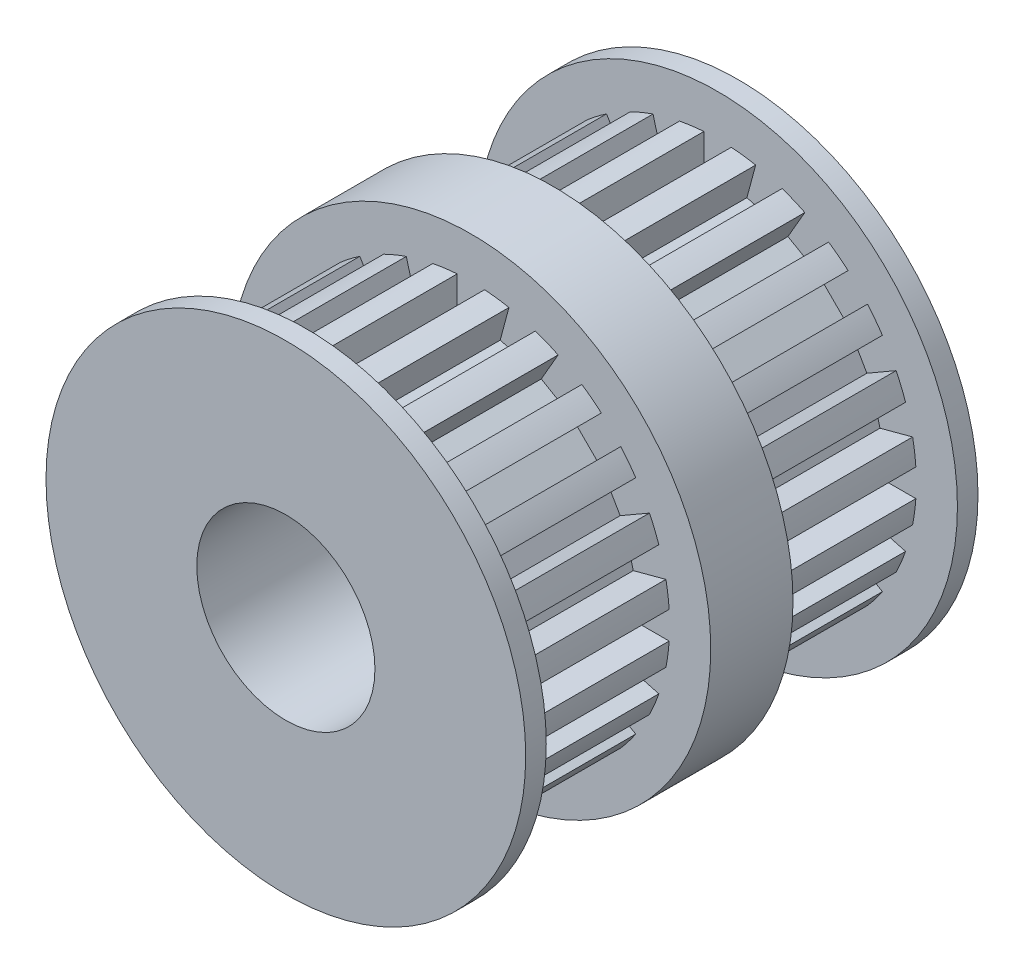
from build123d import *
from build123d.topology import SkipClean

# Parameters (mm, degrees)
SKETCH1_R                = 8.89
BOSS_EXTRUDE1_DEPTH      = 0.762
SKETCH2_R                = 7.366
BOSS_EXTRUDE2_DEPTH      = 6.096
SKETCH3_R                = 8.89
BOSS_EXTRUDE3_DEPTH      = 5.334
SKETCH4_R                = 3.302
CUT_EXTRUDE1_DEPTH       = 57.912
SKETCH5_W                = 6.096
SKETCH5_H                = 1.016
CUT_EXTRUDE2_DEPTH       = 1.27
CIRPATTERN1_COUNT        = 24
CUT_EXTRUDE3_DEPTH       = 152.4
CUT_EXTRUDE3_DEPTH_BACK  = 152.4
SKETCH6_W                = 17.78
SKETCH6_H                = 3.81
SKETCH7_R                = 8.89
BOSS_EXTRUDE4_DEPTH      = 1.524
MIRROR8_COPY_1_SKETCH_W  = 6.096
MIRROR8_COPY_1_SKETCH_H  = 1.016
MIRROR8_COPY_1_DEPTH     = 1.27
MIRROR8_COPY_2_SKETCH_W  = 6.096
MIRROR8_COPY_2_SKETCH_H  = 1.016
MIRROR8_COPY_2_DEPTH     = 1.27
MIRROR8_COPY_3_SKETCH_W  = 6.096
MIRROR8_COPY_3_SKETCH_H  = 1.016
MIRROR8_COPY_3_DEPTH     = 1.27
MIRROR8_COPY_4_SKETCH_W  = 6.096
MIRROR8_COPY_4_SKETCH_H  = 1.016
MIRROR8_COPY_4_DEPTH     = 1.27
MIRROR8_COPY_5_SKETCH_W  = 6.096
MIRROR8_COPY_5_SKETCH_H  = 1.016
MIRROR8_COPY_5_DEPTH     = 1.27
MIRROR8_COPY_6_SKETCH_W  = 6.096
MIRROR8_COPY_6_SKETCH_H  = 1.016
MIRROR8_COPY_6_DEPTH     = 1.27
MIRROR8_COPY_7_SKETCH_W  = 6.096
MIRROR8_COPY_7_SKETCH_H  = 1.016
MIRROR8_COPY_7_DEPTH     = 1.27
MIRROR8_COPY_8_SKETCH_W  = 6.096
MIRROR8_COPY_8_SKETCH_H  = 1.016
MIRROR8_COPY_8_DEPTH     = 1.27
MIRROR8_COPY_9_SKETCH_W  = 6.096
MIRROR8_COPY_9_SKETCH_H  = 1.016
MIRROR8_COPY_9_DEPTH     = 1.27
MIRROR8_COPY_10_SKETCH_W = 6.096
MIRROR8_COPY_10_SKETCH_H = 1.016
MIRROR8_COPY_10_DEPTH    = 1.27
MIRROR8_COPY_11_SKETCH_W = 6.096
MIRROR8_COPY_11_SKETCH_H = 1.016
MIRROR8_COPY_11_DEPTH    = 1.27
MIRROR8_COPY_12_SKETCH_W = 6.096
MIRROR8_COPY_12_SKETCH_H = 1.016
MIRROR8_COPY_12_DEPTH    = 1.27
MIRROR8_COPY_13_SKETCH_W = 6.096
MIRROR8_COPY_13_SKETCH_H = 1.016
MIRROR8_COPY_13_DEPTH    = 1.27
MIRROR8_COPY_14_SKETCH_W = 6.096
MIRROR8_COPY_14_SKETCH_H = 1.016
MIRROR8_COPY_14_DEPTH    = 1.27
MIRROR8_COPY_15_SKETCH_W = 6.096
MIRROR8_COPY_15_SKETCH_H = 1.016
MIRROR8_COPY_15_DEPTH    = 1.27
MIRROR8_COPY_16_SKETCH_W = 6.096
MIRROR8_COPY_16_SKETCH_H = 1.016
MIRROR8_COPY_16_DEPTH    = 1.27
MIRROR8_COPY_17_SKETCH_W = 6.096
MIRROR8_COPY_17_SKETCH_H = 1.016
MIRROR8_COPY_17_DEPTH    = 1.27
MIRROR8_COPY_18_SKETCH_W = 6.096
MIRROR8_COPY_18_SKETCH_H = 1.016
MIRROR8_COPY_18_DEPTH    = 1.27
MIRROR8_COPY_19_SKETCH_W = 6.096
MIRROR8_COPY_19_SKETCH_H = 1.016
MIRROR8_COPY_19_DEPTH    = 1.27
MIRROR8_COPY_20_SKETCH_W = 6.096
MIRROR8_COPY_20_SKETCH_H = 1.016
MIRROR8_COPY_20_DEPTH    = 1.27
MIRROR8_COPY_21_SKETCH_W = 6.096
MIRROR8_COPY_21_SKETCH_H = 1.016
MIRROR8_COPY_21_DEPTH    = 1.27
MIRROR8_COPY_22_SKETCH_W = 6.096
MIRROR8_COPY_22_SKETCH_H = 1.016
MIRROR8_COPY_22_DEPTH    = 1.27
MIRROR8_COPY_23_SKETCH_W = 6.096
MIRROR8_COPY_23_SKETCH_H = 1.016
MIRROR8_COPY_23_DEPTH    = 1.27
MIRROR8_COPY_24_SKETCH_W = 6.096
MIRROR8_COPY_24_SKETCH_H = 1.016
MIRROR8_COPY_24_DEPTH    = 1.27
CUT_EXTRUDE4_START       = -22.098
SKETCH8_R                = 3.302
CUT_EXTRUDE4_DEPTH       = 22.098


with BuildPart() as part:
    # Sketch1 → Boss-Extrude1 (new body)
    with BuildSketch(Plane.XY):
        Circle(SKETCH1_R)
    boss_extrude1 = extrude(amount=-BOSS_EXTRUDE1_DEPTH)

    # Sketch2 → Boss-Extrude2 (add)
    with BuildSketch(Plane(origin=(0, 0, -0.762), x_dir=(-1, 0, 0), z_dir=(0, 0, -1))):
        Circle(SKETCH2_R)
    boss_extrude2 = extrude(amount=BOSS_EXTRUDE2_DEPTH)

    # Sketch3 → Boss-Extrude3 (add)
    with BuildSketch(Plane(origin=(0, 0, -6.858), x_dir=(-1, 0, 0), z_dir=(0, 0, -1))):
        Circle(SKETCH3_R)
    extrude(amount=BOSS_EXTRUDE3_DEPTH)

    # Sketch4 → Cut-Extrude1 (cut)
    with BuildSketch(Plane.XY):
        Circle(SKETCH4_R)
    extrude(amount=-CUT_EXTRUDE1_DEPTH, mode=Mode.SUBTRACT)

    # Sketch5 → Cut-Extrude2 (cut)
    with BuildSketch(Plane.ZY.offset(7.366)):
        with Locations((-3.81, 0)):
            Rectangle(SKETCH5_W, SKETCH5_H)
    cut_extrude2 = extrude(amount=-CUT_EXTRUDE2_DEPTH, mode=Mode.SUBTRACT)

    # CirPattern1: Cut-Extrude2 ×24 about axis
    cirpattern1_axis = Axis((0, 0, -12.192), (0, 0, 1))
    for i in range(1, CIRPATTERN1_COUNT):
        add(cut_extrude2.rotate(cirpattern1_axis, i * 360 / CIRPATTERN1_COUNT), mode=Mode.SUBTRACT)

    # Sketch6 → Cut-Extrude3 (cut, two sides: drawn at the far end of the back side and taken through both)
    with BuildSketch(Plane(origin=(0, 0, 0), x_dir=(1, 0, 0), z_dir=(0, 1, 0)).offset(-CUT_EXTRUDE3_DEPTH_BACK)):
        with Locations((0, 10.287)):
            Rectangle(SKETCH6_W, SKETCH6_H)
    extrude(amount=CUT_EXTRUDE3_DEPTH + CUT_EXTRUDE3_DEPTH_BACK, mode=Mode.SUBTRACT)

    # Sketch7 → Boss-Extrude4 (add)
    with BuildSketch(Plane(origin=(0, 0, -8.382), x_dir=(-1, 0, 0), z_dir=(0, 0, -1))):
        Circle(SKETCH7_R)
    extrude(amount=BOSS_EXTRUDE4_DEPTH)

    # Mirror7: Boss-Extrude2 across plane
    add(boss_extrude2.mirror(Plane(origin=(0, 0, -8.382), x_dir=(1, 0, 0), z_dir=(0, 0, -1))))

    # Mirror8 copy 1 sketch → Mirror8 copy 1 (cut)
    with BuildSketch(Plane(origin=(-7.115009636, -1.906461086, -16.764), x_dir=(0, 0, -1), z_dir=(-0.9659258262890683, -0.25881904510252074, 0))):
        with Locations((-3.81, 0)):
            Rectangle(MIRROR8_COPY_1_SKETCH_W, MIRROR8_COPY_1_SKETCH_H)
    extrude(amount=-MIRROR8_COPY_1_DEPTH, mode=Mode.SUBTRACT)

    # Mirror8 copy 2 sketch → Mirror8 copy 2 (cut)
    with BuildSketch(Plane(origin=(-6.379143124, -3.683, -16.764), x_dir=(0, 0, -1), z_dir=(-0.8660254037844387, -0.49999999999999994, 0))):
        with Locations((-3.81, 0)):
            Rectangle(MIRROR8_COPY_2_SKETCH_W, MIRROR8_COPY_2_SKETCH_H)
    extrude(amount=-MIRROR8_COPY_2_DEPTH, mode=Mode.SUBTRACT)

    # Mirror8 copy 3 sketch → Mirror8 copy 3 (cut)
    with BuildSketch(Plane(origin=(-5.20854855, -5.20854855, -16.764), x_dir=(0, 0, -1), z_dir=(-0.7071067811865476, -0.7071067811865475, 0))):
        with Locations((-3.81, 0)):
            Rectangle(MIRROR8_COPY_3_SKETCH_W, MIRROR8_COPY_3_SKETCH_H)
    extrude(amount=-MIRROR8_COPY_3_DEPTH, mode=Mode.SUBTRACT)

    # Mirror8 copy 4 sketch → Mirror8 copy 4 (cut)
    with BuildSketch(Plane(origin=(-3.683, -6.379143124, -16.764), x_dir=(0, 0, -1), z_dir=(-0.5000000000000001, -0.8660254037844386, 0))):
        with Locations((-3.81, 0)):
            Rectangle(MIRROR8_COPY_4_SKETCH_W, MIRROR8_COPY_4_SKETCH_H)
    extrude(amount=-MIRROR8_COPY_4_DEPTH, mode=Mode.SUBTRACT)

    # Mirror8 copy 5 sketch → Mirror8 copy 5 (cut)
    with BuildSketch(Plane(origin=(-1.906461086, -7.115009636, -16.764), x_dir=(0, 0, -1), z_dir=(-0.25881904510252074, -0.9659258262890683, 0))):
        with Locations((-3.81, 0)):
            Rectangle(MIRROR8_COPY_5_SKETCH_W, MIRROR8_COPY_5_SKETCH_H)
    extrude(amount=-MIRROR8_COPY_5_DEPTH, mode=Mode.SUBTRACT)

    # Mirror8 copy 6 sketch → Mirror8 copy 6 (cut)
    with BuildSketch(Plane(origin=(0, -7.366, -16.764), x_dir=(0, 0, -1), z_dir=(0, -1, 0))):
        with Locations((-3.81, 0)):
            Rectangle(MIRROR8_COPY_6_SKETCH_W, MIRROR8_COPY_6_SKETCH_H)
    extrude(amount=-MIRROR8_COPY_6_DEPTH, mode=Mode.SUBTRACT)

    # Mirror8 copy 7 sketch → Mirror8 copy 7 (cut)
    with BuildSketch(Plane(origin=(1.906461086, -7.115009636, -16.764), x_dir=(0, 0, -1), z_dir=(0.25881904510252085, -0.9659258262890683, 0))):
        with Locations((-3.81, 0)):
            Rectangle(MIRROR8_COPY_7_SKETCH_W, MIRROR8_COPY_7_SKETCH_H)
    extrude(amount=-MIRROR8_COPY_7_DEPTH, mode=Mode.SUBTRACT)

    # Mirror8 copy 8 sketch → Mirror8 copy 8 (cut)
    with BuildSketch(Plane(origin=(3.683, -6.379143124, -16.764), x_dir=(0, 0, -1), z_dir=(0.4999999999999998, -0.8660254037844387, 0))):
        with Locations((-3.81, 0)):
            Rectangle(MIRROR8_COPY_8_SKETCH_W, MIRROR8_COPY_8_SKETCH_H)
    extrude(amount=-MIRROR8_COPY_8_DEPTH, mode=Mode.SUBTRACT)

    # Mirror8 copy 9 sketch → Mirror8 copy 9 (cut)
    with BuildSketch(Plane(origin=(5.20854855, -5.20854855, -16.764), x_dir=(0, 0, -1), z_dir=(0.7071067811865475, -0.7071067811865476, 0))):
        with Locations((-3.81, 0)):
            Rectangle(MIRROR8_COPY_9_SKETCH_W, MIRROR8_COPY_9_SKETCH_H)
    extrude(amount=-MIRROR8_COPY_9_DEPTH, mode=Mode.SUBTRACT)

    # Mirror8 copy 10 sketch → Mirror8 copy 10 (cut)
    with BuildSketch(Plane(origin=(6.379143124, -3.683, -16.764), x_dir=(0, 0, -1), z_dir=(0.8660254037844387, -0.49999999999999994, 0))):
        with Locations((-3.81, 0)):
            Rectangle(MIRROR8_COPY_10_SKETCH_W, MIRROR8_COPY_10_SKETCH_H)
    extrude(amount=-MIRROR8_COPY_10_DEPTH, mode=Mode.SUBTRACT)

    # Mirror8 copy 11 sketch → Mirror8 copy 11 (cut)
    with BuildSketch(Plane(origin=(7.115009636, -1.906461086, -16.764), x_dir=(0, 0, -1), z_dir=(0.9659258262890682, -0.258819045102521, 0))):
        with Locations((-3.81, 0)):
            Rectangle(MIRROR8_COPY_11_SKETCH_W, MIRROR8_COPY_11_SKETCH_H)
    extrude(amount=-MIRROR8_COPY_11_DEPTH, mode=Mode.SUBTRACT)

    # Mirror8 copy 12 sketch → Mirror8 copy 12 (cut)
    with BuildSketch(Plane(origin=(7.366, 0, -16.764), x_dir=(0, 0, -1), z_dir=(1, 0, 0))):
        with Locations((-3.81, 0)):
            Rectangle(MIRROR8_COPY_12_SKETCH_W, MIRROR8_COPY_12_SKETCH_H)
    extrude(amount=-MIRROR8_COPY_12_DEPTH, mode=Mode.SUBTRACT)

    # Mirror8 copy 13 sketch → Mirror8 copy 13 (cut)
    with BuildSketch(Plane(origin=(7.115009636, 1.906461086, -16.764), x_dir=(0, 0, -1), z_dir=(0.9659258262890683, 0.2588190451025208, 0))):
        with Locations((-3.81, 0)):
            Rectangle(MIRROR8_COPY_13_SKETCH_W, MIRROR8_COPY_13_SKETCH_H)
    extrude(amount=-MIRROR8_COPY_13_DEPTH, mode=Mode.SUBTRACT)

    # Mirror8 copy 14 sketch → Mirror8 copy 14 (cut)
    with BuildSketch(Plane(origin=(6.379143124, 3.683, -16.764), x_dir=(0, 0, -1), z_dir=(0.8660254037844386, 0.5000000000000001, 0))):
        with Locations((-3.81, 0)):
            Rectangle(MIRROR8_COPY_14_SKETCH_W, MIRROR8_COPY_14_SKETCH_H)
    extrude(amount=-MIRROR8_COPY_14_DEPTH, mode=Mode.SUBTRACT)

    # Mirror8 copy 15 sketch → Mirror8 copy 15 (cut)
    with BuildSketch(Plane(origin=(5.20854855, 5.20854855, -16.764), x_dir=(0, 0, -1), z_dir=(0.7071067811865477, 0.7071067811865475, 0))):
        with Locations((-3.81, 0)):
            Rectangle(MIRROR8_COPY_15_SKETCH_W, MIRROR8_COPY_15_SKETCH_H)
    extrude(amount=-MIRROR8_COPY_15_DEPTH, mode=Mode.SUBTRACT)

    # Mirror8 copy 16 sketch → Mirror8 copy 16 (cut)
    with BuildSketch(Plane(origin=(3.683, 6.379143124, -16.764), x_dir=(0, 0, -1), z_dir=(0.5000000000000004, 0.8660254037844384, 0))):
        with Locations((-3.81, 0)):
            Rectangle(MIRROR8_COPY_16_SKETCH_W, MIRROR8_COPY_16_SKETCH_H)
    extrude(amount=-MIRROR8_COPY_16_DEPTH, mode=Mode.SUBTRACT)

    # Mirror8 copy 17 sketch → Mirror8 copy 17 (cut)
    with BuildSketch(Plane(origin=(1.906461086, 7.115009636, -16.764), x_dir=(0, 0, -1), z_dir=(0.25881904510252063, 0.9659258262890683, 0))):
        with Locations((-3.81, 0)):
            Rectangle(MIRROR8_COPY_17_SKETCH_W, MIRROR8_COPY_17_SKETCH_H)
    extrude(amount=-MIRROR8_COPY_17_DEPTH, mode=Mode.SUBTRACT)

    # Mirror8 copy 18 sketch → Mirror8 copy 18 (cut)
    with BuildSketch(Plane(origin=(0, 7.366, -16.764), x_dir=(0, 0, -1), z_dir=(0, 1, 0))):
        with Locations((-3.81, 0)):
            Rectangle(MIRROR8_COPY_18_SKETCH_W, MIRROR8_COPY_18_SKETCH_H)
    extrude(amount=-MIRROR8_COPY_18_DEPTH, mode=Mode.SUBTRACT)

    # Mirror8 copy 19 sketch → Mirror8 copy 19 (cut)
    with BuildSketch(Plane(origin=(-1.906461086, 7.115009636, -16.764), x_dir=(0, 0, -1), z_dir=(-0.2588190451025203, 0.9659258262890684, 0))):
        with Locations((-3.81, 0)):
            Rectangle(MIRROR8_COPY_19_SKETCH_W, MIRROR8_COPY_19_SKETCH_H)
    extrude(amount=-MIRROR8_COPY_19_DEPTH, mode=Mode.SUBTRACT)

    # Mirror8 copy 20 sketch → Mirror8 copy 20 (cut)
    with BuildSketch(Plane(origin=(-3.683, 6.379143124, -16.764), x_dir=(0, 0, -1), z_dir=(-0.5000000000000001, 0.8660254037844386, 0))):
        with Locations((-3.81, 0)):
            Rectangle(MIRROR8_COPY_20_SKETCH_W, MIRROR8_COPY_20_SKETCH_H)
    extrude(amount=-MIRROR8_COPY_20_DEPTH, mode=Mode.SUBTRACT)

    # Mirror8 copy 21 sketch → Mirror8 copy 21 (cut)
    with BuildSketch(Plane(origin=(-5.20854855, 5.20854855, -16.764), x_dir=(0, 0, -1), z_dir=(-0.7071067811865474, 0.7071067811865477, 0))):
        with Locations((-3.81, 0)):
            Rectangle(MIRROR8_COPY_21_SKETCH_W, MIRROR8_COPY_21_SKETCH_H)
    extrude(amount=-MIRROR8_COPY_21_DEPTH, mode=Mode.SUBTRACT)

    # Mirror8 copy 22 sketch → Mirror8 copy 22 (cut)
    with BuildSketch(Plane(origin=(-6.379143124, 3.683, -16.764), x_dir=(0, 0, -1), z_dir=(-0.8660254037844384, 0.5000000000000004, 0))):
        with Locations((-3.81, 0)):
            Rectangle(MIRROR8_COPY_22_SKETCH_W, MIRROR8_COPY_22_SKETCH_H)
    extrude(amount=-MIRROR8_COPY_22_DEPTH, mode=Mode.SUBTRACT)

    # Mirror8 copy 23 sketch → Mirror8 copy 23 (cut)
    with BuildSketch(Plane(origin=(-7.115009636, 1.906461086, -16.764), x_dir=(0, 0, -1), z_dir=(-0.9659258262890683, 0.2588190451025207, 0))):
        with Locations((-3.81, 0)):
            Rectangle(MIRROR8_COPY_23_SKETCH_W, MIRROR8_COPY_23_SKETCH_H)
    extrude(amount=-MIRROR8_COPY_23_DEPTH, mode=Mode.SUBTRACT)

    # Mirror8 copy 24 sketch → Mirror8 copy 24 (cut)
    with BuildSketch(Plane(origin=(-7.366, 0, -16.764), x_dir=(0, 0, -1), z_dir=(-1, 0, 0))):
        with Locations((-3.81, 0)):
            Rectangle(MIRROR8_COPY_24_SKETCH_W, MIRROR8_COPY_24_SKETCH_H)
    extrude(amount=-MIRROR8_COPY_24_DEPTH, mode=Mode.SUBTRACT)

    # Mirror9: Boss-Extrude1 across plane
    add(boss_extrude1.mirror(Plane(origin=(0, 0, -8.382), x_dir=(1, 0, 0), z_dir=(0, 0, -1))))

    # Sketch8 → Cut-Extrude4 (cut)
    with SkipClean():  # the faces are left unmerged after this step: merging them gives an invalid solid
        with BuildSketch(Plane(origin=(0, 0, -16.764), x_dir=(-1, 0, 0), z_dir=(0, 0, -1)).offset(CUT_EXTRUDE4_START)):
            Circle(SKETCH8_R)
        extrude(amount=CUT_EXTRUDE4_DEPTH, mode=Mode.SUBTRACT)


solid = part.part
